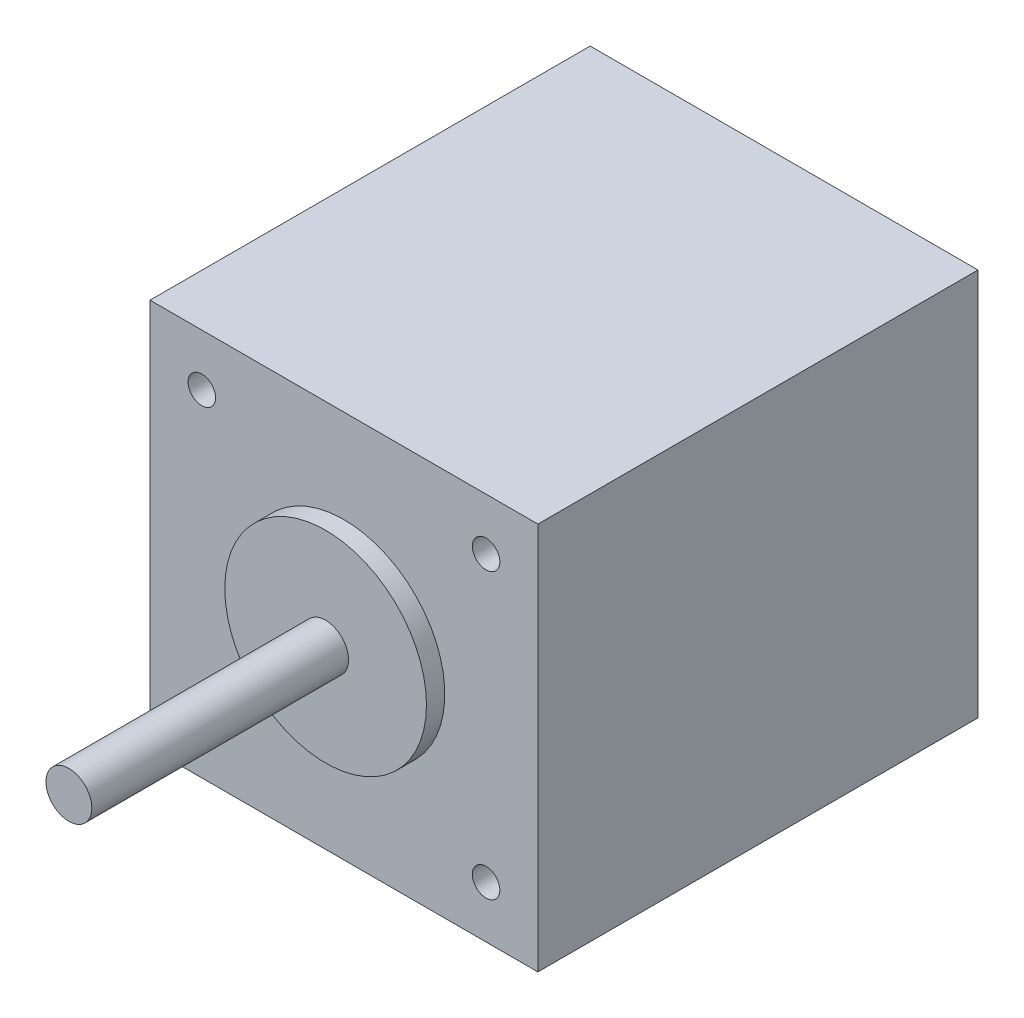
from build123d import *

# Parameters (mm, degrees)
SKETCH_1_W          = 42.3
SKETCH_1_H          = 42.3
EXTRUDE_1492_DEPTH  = 48
SKETCH_2_R          = 2.5
EXTRUDE_1547_DEPTH  = 78
SKETCH_3_R          = 11
EXTRUDE_1594_DEPTH  = 50
CUT_EXTRUDE_START   = 48
SKETCH_5_R          = 1.5
CUT_EXTRUDE_3_DEPTH = 4.5


with BuildPart() as part:
    # Эскиз1 → Extrude 1492 (new body)
    with BuildSketch(Plane.XY):
        Rectangle(SKETCH_1_W, SKETCH_1_H)
    extrude(amount=EXTRUDE_1492_DEPTH)

    # Эскиз2 → Extrude 1547 (add)
    with BuildSketch(Plane.XY):
        Circle(SKETCH_2_R)
    extrude(amount=EXTRUDE_1547_DEPTH)

    # Эскиз3 → Extrude 1594 (add)
    with BuildSketch(Plane.XY):
        Circle(SKETCH_3_R)
    extrude(amount=EXTRUDE_1594_DEPTH)

    # Эскиз5 → Крепеж_М3_ПРЕДВ (cut)
    with BuildSketch(Plane.XY.offset(CUT_EXTRUDE_START)):
        with Locations((-15.5, -15.5)):
            Circle(SKETCH_5_R)
        with Locations((-15.5, 15.5)):
            Circle(SKETCH_5_R)
        with Locations((15.5, -15.5)):
            Circle(SKETCH_5_R)
        with Locations((15.5, 15.5)):
            Circle(SKETCH_5_R)
    extrude(amount=-CUT_EXTRUDE_3_DEPTH, mode=Mode.SUBTRACT)


solid = part.part
